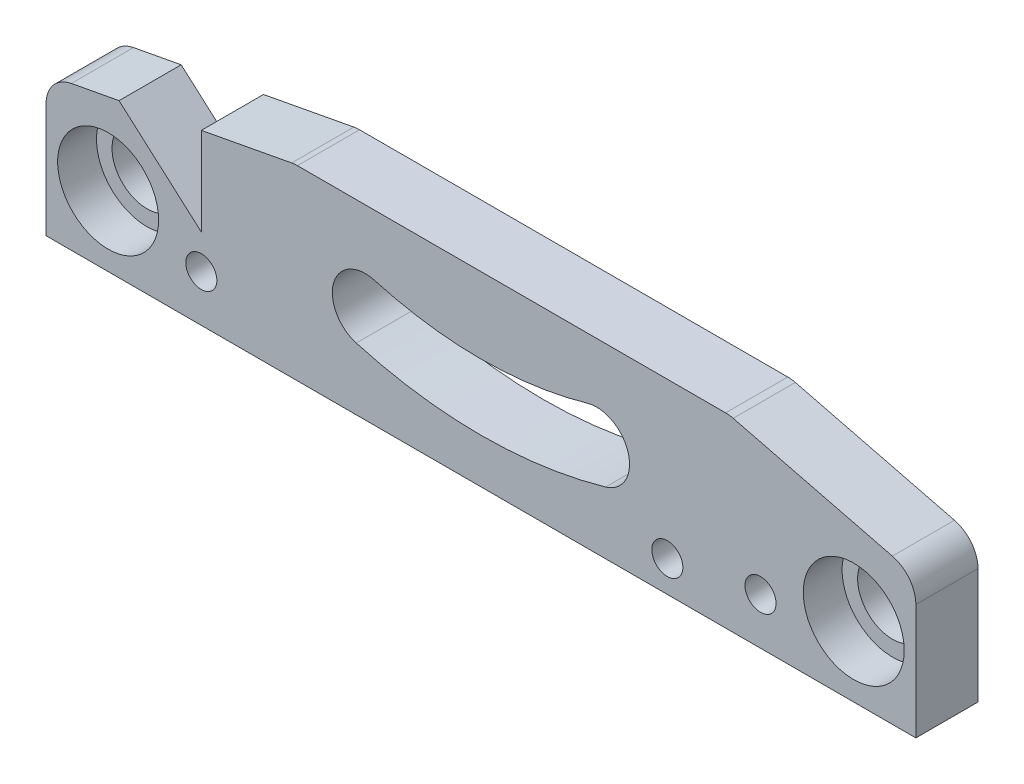
from build123d import *

# Parameters (mm, degrees)
SKETCH1_W          = 88.9
SKETCH1_H          = 19.05
BASE_EXTRUDE_DEPTH = 6.35
CUT_EXTRUDE1_DEPTH = 49.775275499
CUT_EXTRUDE3_DEPTH = 49.775275499
CUT_EXTRUDE4_DEPTH = 49.775275499
CUT_EXTRUDE5_DEPTH = 49.775275499
FILLET1_R          = 3.175
HOLE1_D            = 7.14375
HOLE1_CBORE_D      = 10.31875
HOLE1_CBORE_DEPTH  = 3.96875
LPATTERN1_COUNT    = 2
LPATTERN1_PITCH    = 76.2
HOLE2_OUTLINE_R    = 1.5875
HOLE2_DEPTH        = 6.35
HOLE3_OUTLINE_R    = 1.5875
HOLE3_DEPTH        = 6.35
LPATTERN2_COUNT    = 2
LPATTERN2_PITCH    = 57.15


# Read off the part's stored shape, not the designer's step: Hole2, Hole3
with BuildPart() as part:
    # Sketch1 → Base-Extrude (new body)
    with BuildSketch(Plane.XY):
        with Locations((0, 9.525)):
            Rectangle(SKETCH1_W, SKETCH1_H)
    extrude(amount=BASE_EXTRUDE_DEPTH)

    # Sketch2 → Cut-Extrude1 (cut, through all)
    with BuildSketch(Plane.XY.offset(6.35)):
        Polygon((44.45, 14.2875), (25.4, 19.05), (44.45, 19.05), align=None)
    extrude(amount=-CUT_EXTRUDE1_DEPTH, mode=Mode.SUBTRACT)

    # Sketch4 → Cut-Extrude3 (cut, through all)
    with BuildSketch(Plane.XY.offset(6.35)):
        Polygon((-231.275885049, -20.742353447), (-44.45, 14.2875), (-19.05, 19.05), (167.775885049, 54.079853447), (97.716178156, 427.731623544), (-301.335591942, 352.909416651), align=None)
    extrude(amount=-CUT_EXTRUDE3_DEPTH, mode=Mode.SUBTRACT)

    # Sketch5 → Cut-Extrude4 (cut, through all)
    with BuildSketch(Plane.XY.offset(6.35)):
        Polygon((-36.984386732, 15.687302488), (-28.575, 8.262261056), (-28.575, 17.2640625), align=None)
    extrude(amount=-CUT_EXTRUDE4_DEPTH, mode=Mode.SUBTRACT)

    # Sketch6 → Cut-Extrude5 (cut, through all)
    with BuildSketch(Plane.XY.offset(6.35)):
        with BuildLine():
            ThreePointArc((-10.884660771, 12.84067681), (0, 11.3109375), (10.884660771, 12.84067681))
            ThreePointArc((10.884660771, 12.84067681), (15.057262416, 10.52776595), (12.744351556, 6.355164305))
            ThreePointArc((12.744351556, 6.355164305), (0, 4.5640625), (-12.744351556, 6.355164305))
            ThreePointArc((-12.744351556, 6.355164305), (-15.057262416, 10.52776595), (-10.884660771, 12.84067681))
        make_face()
    extrude(amount=-CUT_EXTRUDE5_DEPTH, mode=Mode.SUBTRACT)

    # Fillet1
    fillet1_edges = [part.edges().sort_by_distance(p)[0] for p in [
        (44.45, 14.2875, 3.175),
        (25.4, 19.05, 3.175),
        (-19.05, 19.05, 3.175),
        (-44.45, 14.2875, 3.175),
    ]]
    fillet(fillet1_edges, radius=FILLET1_R)

    # Hole1 (through all)
    with Locations(Plane.XY.offset(6.35)):
        with Locations((38.1, 7.14375)):
            hole1 = CounterBoreHole(HOLE1_D / 2, HOLE1_CBORE_D / 2, HOLE1_CBORE_DEPTH)

    # LPattern1: Hole1 ×2
    with Locations(*[(-i * LPATTERN1_PITCH, 0, 0) for i in range(1, LPATTERN1_COUNT)]):
        add(hole1, mode=Mode.SUBTRACT)

    # Hole2 outline → Hole2 (cut)
    with BuildSketch(Plane.XY):
        with Locations((28.575, 4.7625)):
            Circle(HOLE2_OUTLINE_R)
    hole2 = extrude(amount=HOLE2_DEPTH, mode=Mode.SUBTRACT)

    # Hole3 outline → Hole3 (cut)
    with BuildSketch(Plane.XY):
        with Locations((19.05, 3.175)):
            Circle(HOLE3_OUTLINE_R)
    extrude(amount=HOLE3_DEPTH, mode=Mode.SUBTRACT)

    # LPattern2: Hole2 ×2
    with Locations(*[(-i * LPATTERN2_PITCH, 0, 0) for i in range(1, LPATTERN2_COUNT)]):
        add(hole2, mode=Mode.SUBTRACT)


solid = part.part
